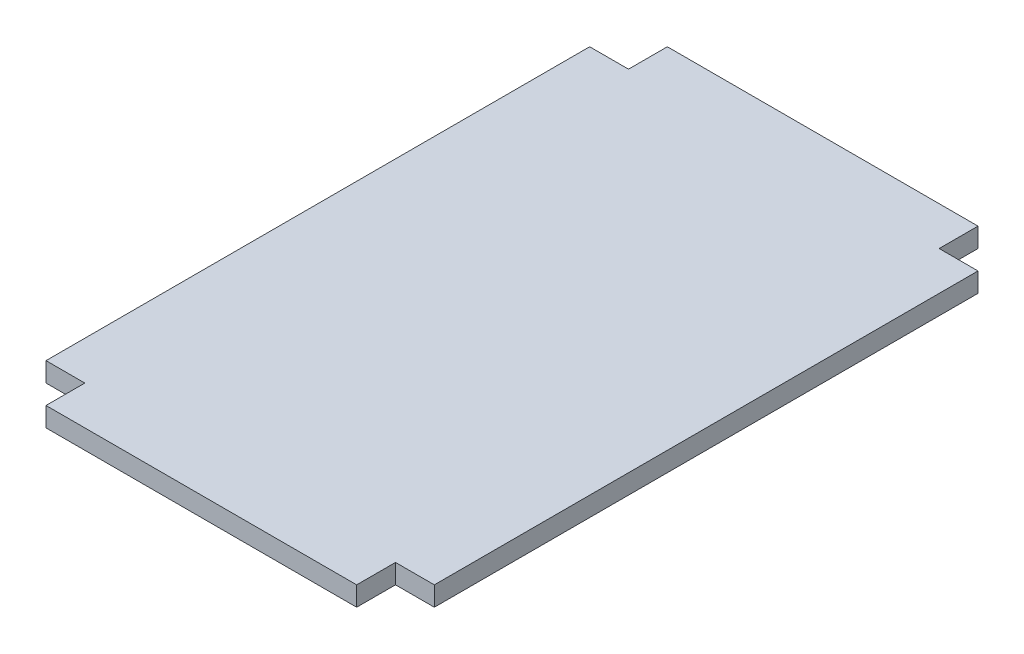
from build123d import *

# Parameters (mm, degrees)
BOSS_EXTRUDE1_DEPTH = 19.05


with BuildPart() as part:
    # Sketch1 → Boss-Extrude1 (new body)
    with BuildSketch(Plane(origin=(0, 0, 0), x_dir=(1, 0, 0), z_dir=(0, 1, 0))):
        Polygon((-194.750523985, 375.216103092), (-194.750523985, -158.183896908), (-156.650523985, -158.183896908), (-156.650523985, -196.283896908), (148.149476015, -196.283896908), (148.149476015, -158.183896908), (186.249476015, -158.183896908), (186.249476015, 375.216103092), (148.149476015, 375.216103092), (148.149476015, 413.316103092), (-156.650523985, 413.316103092), (-156.650523985, 375.216103092), align=None)
    extrude(amount=BOSS_EXTRUDE1_DEPTH)


solid = part.part
